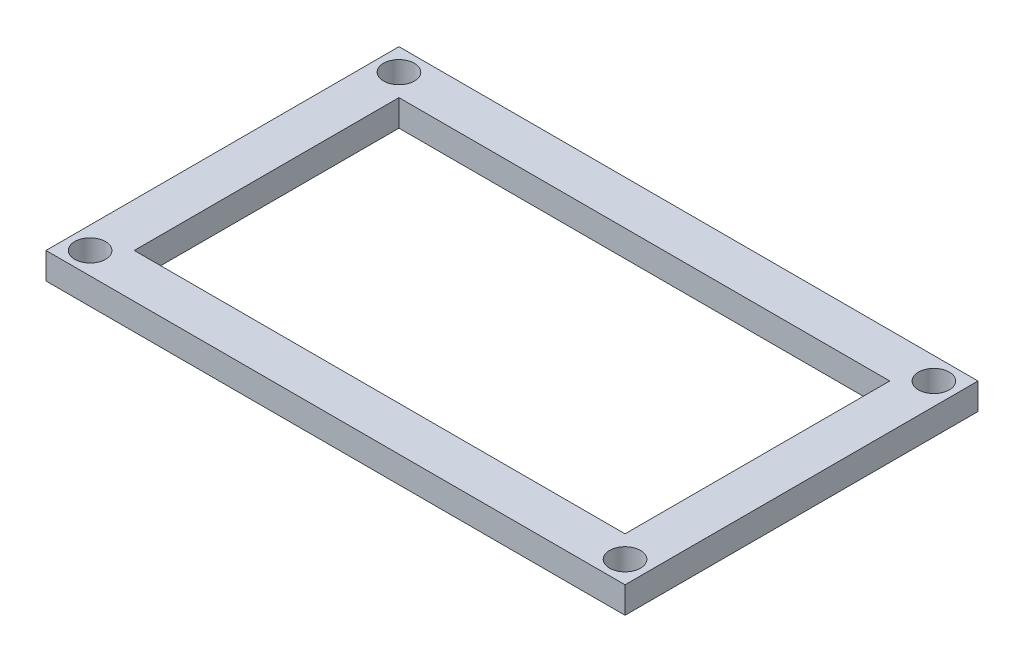
from build123d import *

# Parameters (mm, degrees)
CROQUIS1_W              = 65.621778264
CROQUIS1_H              = 40
CROQUIS1_R              = 1.75
CROQUIS1_W_2            = 55.621778264
CROQUIS1_H_2            = 30
SALIENTE_EXTRUIR1_DEPTH = 3


with BuildPart() as part:
    # Croquis1 → Saliente-Extruir1 (new body)
    with BuildSketch(Plane(origin=(0, 0, 0), x_dir=(1, 0, 0), z_dir=(0, 1, 0))):
        with Locations((0, -17.5)):
            Rectangle(CROQUIS1_W, CROQUIS1_H)
        with Locations((30.310889132, 0)):
            Circle(CROQUIS1_R, mode=Mode.SUBTRACT)
        with Locations((-30.310889132, 0)):
            Circle(CROQUIS1_R, mode=Mode.SUBTRACT)
        with Locations((-30.310889132, -35)):
            Circle(CROQUIS1_R, mode=Mode.SUBTRACT)
        with Locations((30.310889132, -35)):
            Circle(CROQUIS1_R, mode=Mode.SUBTRACT)
        with Locations((0, -17.5)):
            Rectangle(CROQUIS1_W_2, CROQUIS1_H_2, mode=Mode.SUBTRACT)
    extrude(amount=SALIENTE_EXTRUIR1_DEPTH)


solid = part.part
